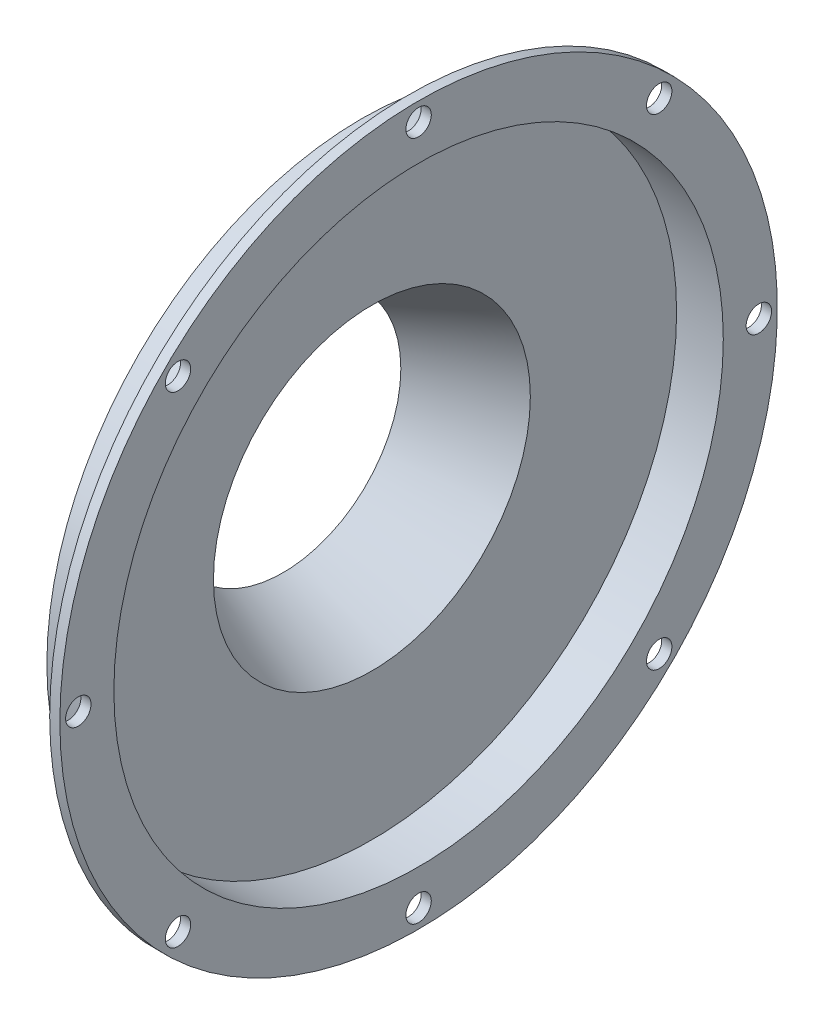
from build123d import *

# Parameters (mm, degrees)
SKETCH2_R          = 3.175
CUT_EXTRUDE1_DEPTH = 2.54
CIRPATTERN1_COUNT  = 8


with BuildPart() as part:
    # Sketch1 → Revolve1 (revolve)
    with BuildSketch(Plane.XY):
        Polygon((0, 29.464), (22.225, 39.624), (22.225, 76.2), (33.90141791, 76.2), (33.90141791, 89.7128), (31.36141791, 89.7128), (31.36141791, 78.74), (19.685, 78.74), (19.685, 41.255678787), (-1.056029791, 31.774065168), align=None)
    revolve(axis=Axis((0, 0, 0), (1, 0, 0)))

    # Sketch2 → Cut-Extrude1 (cut)
    with BuildSketch(Plane.ZY.offset(-31.36141791)):
        with Locations((0, 85.09)):
            Circle(SKETCH2_R)
    cut_extrude1 = extrude(amount=-CUT_EXTRUDE1_DEPTH, mode=Mode.SUBTRACT)

    # CirPattern1: Cut-Extrude1 ×8 about axis
    cirpattern1_axis = Axis((31.36141791, 0, 0), (-1, 0, 0))
    for i in range(1, CIRPATTERN1_COUNT):
        add(cut_extrude1.rotate(cirpattern1_axis, i * 360 / CIRPATTERN1_COUNT), mode=Mode.SUBTRACT)


solid = part.part
